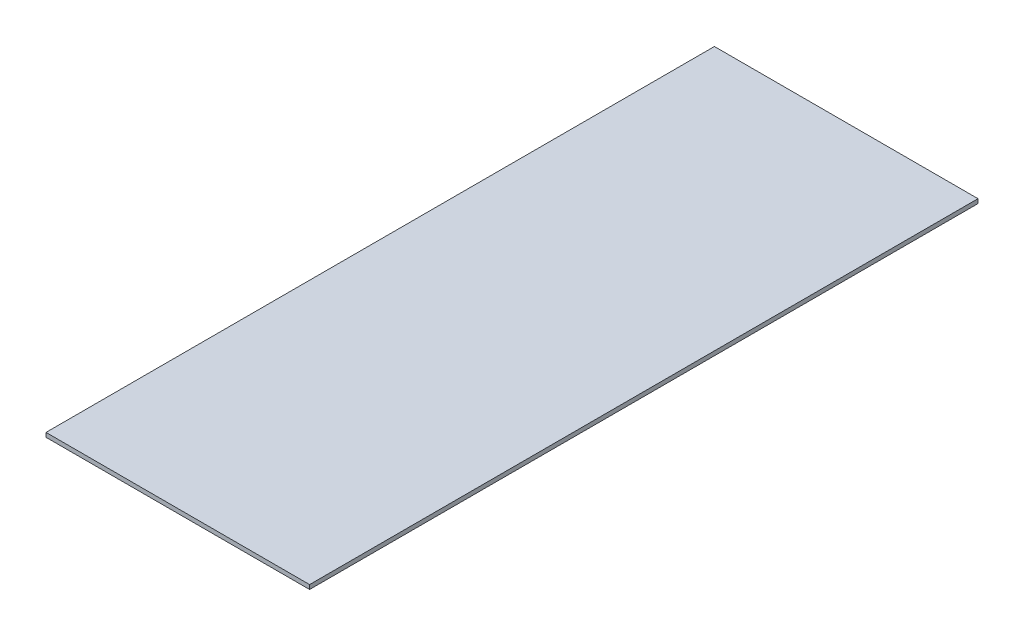
from build123d import *

# Parameters (mm, degrees)
SKETCH_1_W      = 185.06
SKETCH_1_H      = 469.28
EXTRUDE_1_DEPTH = 3


with BuildPart() as part:
    # 草图1 → 凸台-拉伸1 (new body)
    with BuildSketch(Plane(origin=(0, 0, 0), x_dir=(1, 0, 0), z_dir=(0, 1, 0))):
        Rectangle(SKETCH_1_W, SKETCH_1_H)
    extrude(amount=EXTRUDE_1_DEPTH)


solid = part.part
